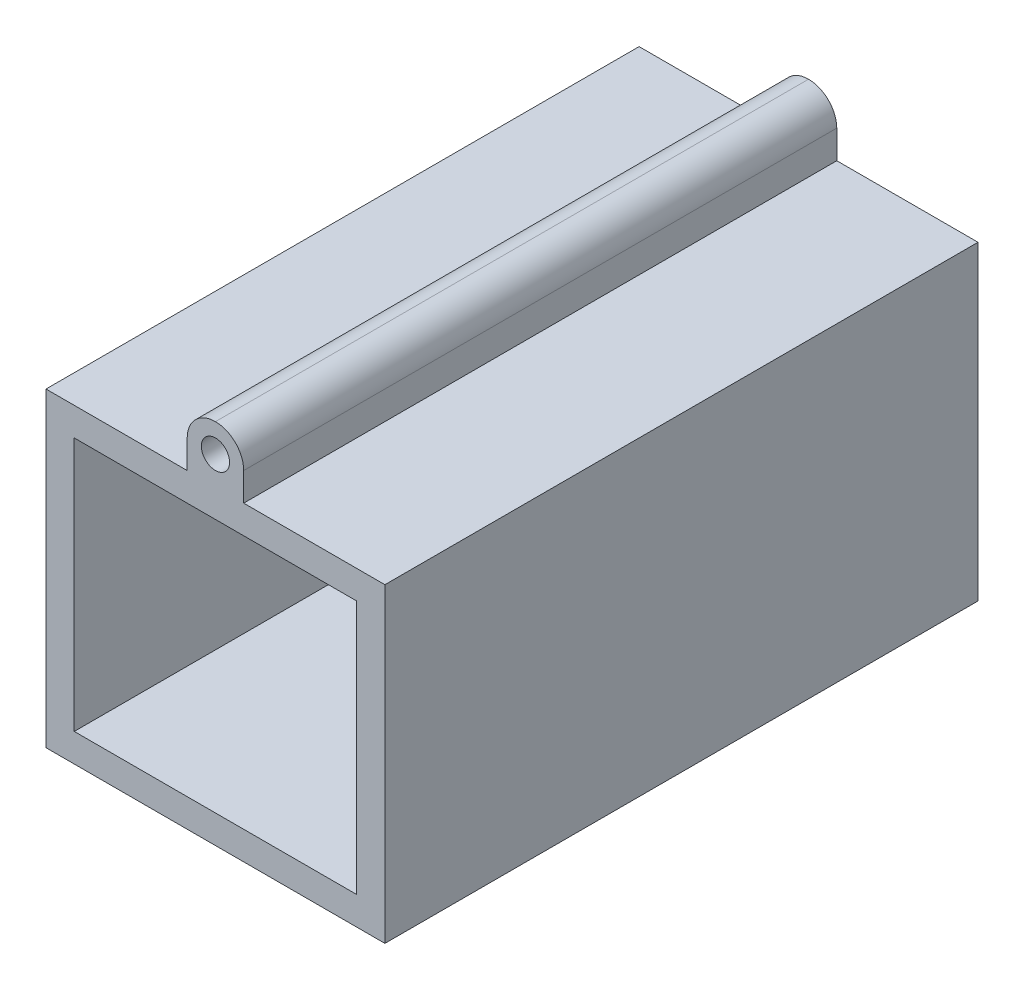
from build123d import *

# Parameters (mm, degrees)
SKETCH3_W           = 60
SKETCH3_H           = 55
SKETCH3_W_2         = 50
SKETCH3_H_2         = 45
BOSS_EXTRUDE1_DEPTH = 105
SKETCH6_W           = 50
SKETCH6_H           = 5
BOSS_EXTRUDE3_DEPTH = 10
SKETCH7_W           = 10
SKETCH7_H           = 105
BOSS_EXTRUDE4_DEPTH = 10
FILLET1_R           = 5
SKETCH8_R           = 2.5
CUT_EXTRUDE1_DEPTH  = 116.461032388


with BuildPart() as part:
    # Sketch3 → Boss-Extrude1 (new body)
    with BuildSketch(Plane.XY):
        Rectangle(SKETCH3_W, SKETCH3_H)
        Rectangle(SKETCH3_W_2, SKETCH3_H_2, mode=Mode.SUBTRACT)
    extrude(amount=-BOSS_EXTRUDE1_DEPTH)

    # Sketch6 → Boss-Extrude3 (add)
    with BuildSketch(Plane(origin=(0, -22.5, 0), x_dir=(1, 0, 0), z_dir=(0, 1, 0))):
        with Locations((0, 102.5)):
            Rectangle(SKETCH6_W, SKETCH6_H)
    extrude(amount=BOSS_EXTRUDE3_DEPTH)

    # Sketch7 → Boss-Extrude4 (add)
    with BuildSketch(Plane(origin=(0, 27.5, 0), x_dir=(1, 0, 0), z_dir=(0, 1, 0))):
        with Locations((0, 52.5)):
            Rectangle(SKETCH7_W, SKETCH7_H)
    extrude(amount=BOSS_EXTRUDE4_DEPTH)

    # Fillet1
    fillet1_edges = [part.edges().sort_by_distance(p)[0] for p in [
        (5, 37.5, -52.5),
        (-5, 37.5, -52.5),
    ]]
    fillet(fillet1_edges, radius=FILLET1_R - 0.0001)  # a hair under: the kernel refuses the full size

    # Sketch8 → Cut-Extrude1 (cut, through all)
    with BuildSketch(Plane.XY):
        with Locations((0, 32.5)):
            Circle(SKETCH8_R)
    extrude(amount=-CUT_EXTRUDE1_DEPTH, mode=Mode.SUBTRACT)


solid = part.part
